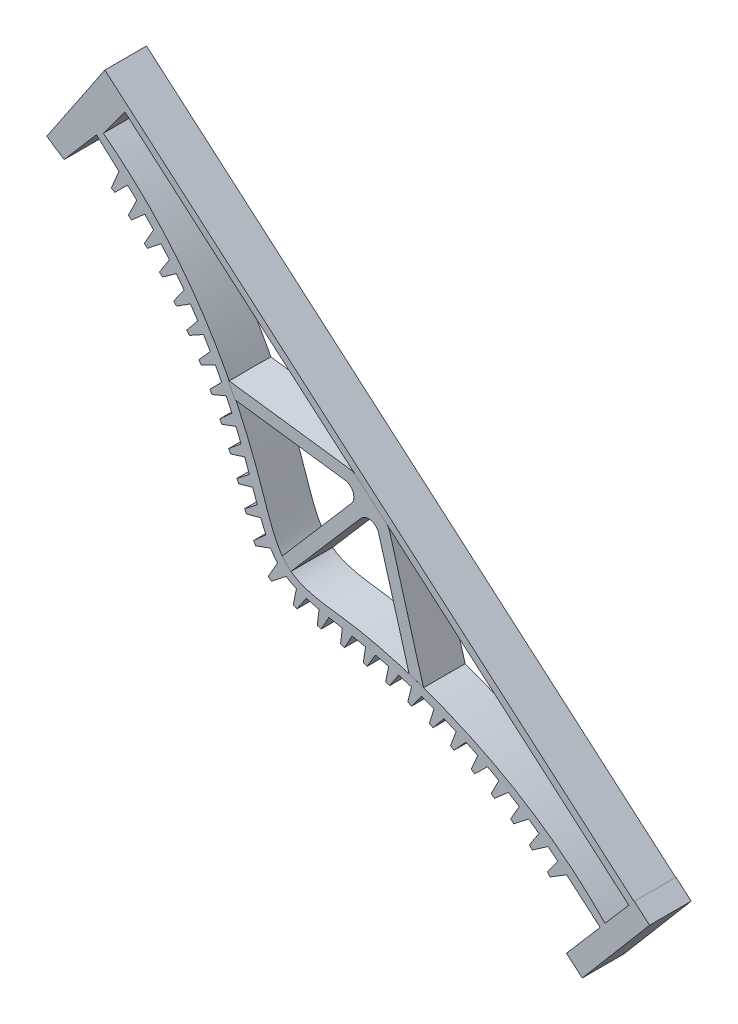
from build123d import *

# Parameters (mm, degrees)
BOSS_EXTRUDE6_DEPTH  = 10.16
BOSS_EXTRUDE8_DEPTH  = 10.16
CRVPATTERN5_DEPTH    = 10.16
CRVPATTERN6_DEPTH    = 10.16
BOSS_EXTRUDE9_DEPTH  = 10.16
CUT_EXTRUDE1_DEPTH   = 156.475771411
BOSS_EXTRUDE14_DEPTH = 10.16
FILLET1_R            = 2.54


# Read off the part's stored shape, not the designer's step: CrvPattern5, CrvPattern6
with BuildPart() as part:
    # Sketch2 → Boss-Extrude6 (new body)
    with BuildSketch(Plane.XY):
        with BuildLine():
            add(Edge.make_bspline(
                [(-35.566744562, -9.717940548), (-35.468273926, -9.80268902), (-35.272184012, -9.972283435), (-34.907747582, -10.289670464), (-34.394942503, -10.740976788), (-33.798605446, -11.272890933), (-33.123111447, -11.886627028), (-32.316267663, -12.633326559), (-31.412693701, -13.490653796), (-30.518151088, -14.360103422), (-29.634400344, -15.240145055), (-28.543077059, -16.353522475), (-26.396607195, -18.615276483), (-23.713782162, -21.656048668), (-20.596239567, -25.554690448), (-17.703677778, -29.621650364), (-15.658303963, -32.755672364), (-14.037784885, -35.419798839), (-12.792049027, -37.581120217), (-11.298499122, -40.318429855), (-9.889444022, -43.100594043), (-8.564055073, -45.923468933), (-7.069419373, -49.353845087), (-5.66633338, -52.822966294), (-4.222966232, -56.712334789), (-2.728926064, -61.014575608), (-1.359536835, -64.920043451), (-0.106422008, -68.089367972), (1.153318255, -70.560325637), (2.146647049, -72.003625432), (2.734637198, -72.70691507), (3.005302915, -73.003115021), (3.012330371, -73.01078778)],
                knots=[0.083325531, 0.083325531, 0.083325531, 0.083325531, 0.083325531, 0.086723077, 0.090120623, 0.093518169, 0.096915715, 0.103710808, 0.1105059, 0.117300992, 0.124096085, 0.130891177, 0.137686269, 0.15127645, 0.192046993, 0.219227344, 0.246407696, 0.259997928, 0.273588159, 0.287178391, 0.300768623, 0.327948999, 0.341539187, 0.355129375, 0.382309728, 0.409490081, 0.431935904, 0.454381728, 0.472501988, 0.483716791, 0.492234559, 0.492461315, 0.492461315, 0.492461315, 0.492461315, 0.492461315], degree=4))
            Line((3.012330371, -73.01078778), (3.72649136, -72.106293556))
            Line((3.72649136, -72.106293556), (5.99059072, -73.893957194))
            Line((5.99059072, -73.893957194), (5.104826211, -74.811688355))
            add(Edge.make_bspline(
                [(5.104826211, -74.811688355), (5.113460155, -74.817494525), (5.446672603, -75.04102028), (6.229700324, -75.517692441), (7.804858241, -76.284958304), (10.435895579, -77.162576083), (13.75651681, -77.929645893), (17.822397533, -78.701988936), (22.299176943, -79.538583191), (26.970692469, -80.513886582), (31.816888291, -81.703226437), (36.010904633, -82.918588605), (39.564133566, -84.093159712), (42.49337208, -85.162386318), (44.816134604, -86.072242532), (47.69193988, -87.277888441), (51.095630104, -88.833571079), (54.435029965, -90.524514354), (57.703065189, -92.347918119), (60.375906986, -93.954370982), (62.482118132, -95.290579627), (64.556074604, -96.677991156), (66.594514759, -98.114049491), (68.34952435, -99.415450724), (69.826596154, -100.557231318), (70.9293454, -101.439077199), (71.637159571, -102.0158813), (72.251943879, -102.526315304), (72.774573956, -102.966153295), (73.142715833, -103.279257697), (73.339627576, -103.447899037), (73.438098212, -103.532647509)],
                knots=[0.507538685, 0.507538685, 0.507538685, 0.507538685, 0.507538685, 0.507765441, 0.516283209, 0.527498012, 0.545618272, 0.568064096, 0.590509919, 0.617690272, 0.644870625, 0.672051001, 0.699231377, 0.712821609, 0.726411841, 0.740002072, 0.753592304, 0.780772656, 0.807953007, 0.821543188, 0.835133369, 0.84872355, 0.862313731, 0.875903915, 0.8894941, 0.896289192, 0.903084285, 0.906481831, 0.909879377, 0.913276923, 0.916674469, 0.916674469, 0.916674469, 0.916674469, 0.916674469], degree=4))
            Line((73.438098212, -103.532647509), (83.064544319, -111.816459153))
            Line((83.064544319, -111.816459153), (91.461797953, -102.288808266))
            Line((91.461797953, -102.288808266), (-39.143763814, 10.116495872))
            Line((-39.143763814, 10.116495872), (-44.961714586, -1.172500931))
            Line((-44.961714586, -1.172500931), (-35.566744562, -9.717940548))
        make_face()
    extrude(amount=BOSS_EXTRUDE6_DEPTH)

    # Sketch2<7> → Boss-Extrude8 (add)
    with BuildSketch(Plane.XY):
        Polygon((1.515996018, -77.644263482), (5.104826211, -74.811688355), (5.99059072, -73.893957194), (3.72649136, -72.106293556), (3.012330371, -73.01078778), (0.745926279, -76.981505157), align=None)
    extrude(amount=BOSS_EXTRUDE8_DEPTH)

    # CrvPattern5 outline → CrvPattern5 (add)
    with BuildSketch(Plane.XY):
        with BuildLine():
            add(Edge.make_bspline(
                [(0.147175899, -68.491062068), (0.327775611, -68.878310959), (0.605306675, -69.446537197), (0.900945427, -70.005719758), (1.220022533, -70.551572208), (1.326099699, -70.726958223)],
                knots=[0.463190678, 0.463190678, 0.463190678, 0.463190678, 0.463190678, 0.472501988, 0.476969023, 0.476969023, 0.476969023, 0.476969023, 0.476969023], degree=4))
            Line((0.147175899, -68.491062068), (-2.838675188, -71.189223171))
            Line((-2.838675188, -71.189223171), (-2.313839213, -72.059167537))
            Line((-2.313839213, -72.059167537), (1.326099699, -70.726958223))
        make_face()
        with BuildLine():
            Line((-36.714305712, -14.542892494), (-33.618073955, -11.438101102))
            add(Edge.make_bspline(
                [(-35.566744562, -9.717940548), (-35.468273926, -9.80268902), (-35.272184012, -9.972283435), (-34.907747582, -10.289670464), (-34.394942503, -10.740976788), (-34.018378593, -11.076860107), (-33.768860143, -11.301597859), (-33.636101524, -11.421771425), (-33.618073955, -11.438101102)],
                knots=[0.083325531, 0.083325531, 0.083325531, 0.083325531, 0.083325531, 0.086723077, 0.090120623, 0.093518169, 0.096915715, 0.097450175, 0.097450175, 0.097450175, 0.097450175, 0.097450175], degree=4))
            Line((-35.566744562, -9.717940548), (-35.683133951, -9.612075549))
            Line((-35.683133951, -9.612075549), (-35.776779601, -9.764905641))
            Line((-35.776779601, -9.764905641), (-37.55739132, -13.975915723))
            Line((-37.55739132, -13.975915723), (-36.714305712, -14.542892494))
        make_face()
        with BuildLine():
            Line((-32.611453468, -18.346695657), (-29.406745404, -15.474808236))
            add(Edge.make_bspline(
                [(-31.353942471, -13.551455916), (-31.25678673, -13.644907913), (-30.935526994, -13.955001159), (-30.445847692, -14.433132295), (-29.96049992, -14.915514742), (-29.573572794, -15.305586998), (-29.406745404, -15.474808236)],
                knots=[0.114362027, 0.114362027, 0.114362027, 0.114362027, 0.114362027, 0.117300992, 0.124096085, 0.129274796, 0.129274796, 0.129274796, 0.129274796, 0.129274796], degree=4))
            Line((-31.353942471, -13.551455916), (-31.407513849, -13.628789028))
            Line((-31.407513849, -13.628789028), (-33.421424113, -17.733341311))
            Line((-33.421424113, -17.733341311), (-32.611453468, -18.346695657))
        make_face()
        with BuildLine():
            Line((-28.729129415, -22.373483259), (-25.434757325, -19.738533799))
            add(Edge.make_bspline(
                [(-27.256709982, -17.722583897), (-27.098956679, -17.892573693), (-26.638343948, -18.391912238), (-26.182126752, -18.895294076), (-25.730357917, -19.402660241), (-25.434757325, -19.738533799)],
                knots=[0.146222357, 0.146222357, 0.146222357, 0.146222357, 0.146222357, 0.15127645, 0.161027324, 0.161027324, 0.161027324, 0.161027324, 0.161027324], degree=4))
            Line((-27.256709982, -17.722583897), (-27.262815225, -17.730420017))
            Line((-27.262815225, -17.730420017), (-29.503472535, -21.715722868))
            Line((-29.503472535, -21.715722868), (-28.729129415, -22.373483259))
        make_face()
        with BuildLine():
            Line((-25.076992645, -26.613245044), (-21.711663157, -24.217879367))
            add(Edge.make_bspline(
                [(-23.396101972, -22.127346621), (-22.989241558, -22.619061041), (-22.565622218, -23.139716039), (-22.146533887, -23.66402646), (-21.732020448, -24.19193057), (-21.711663157, -24.217879367)],
                knots=[0.178138223, 0.178138223, 0.178138223, 0.178138223, 0.178138223, 0.192046993, 0.19276576, 0.19276576, 0.19276576, 0.19276576, 0.19276576], degree=4))
            Line((-23.396101972, -22.127346621), (-25.8132696, -25.913136306))
            Line((-25.8132696, -25.913136306), (-25.076992645, -26.613245044))
        make_face()
        with BuildLine():
            Line((-21.668264101, -31.050120924), (-18.250637845, -28.894773341))
            add(Edge.make_bspline(
                [(-19.793916618, -26.741123604), (-19.543831531, -27.080854092), (-19.154045374, -27.616436332), (-18.76883609, -28.155330611), (-18.388238863, -28.69747331), (-18.250637845, -28.894773341)],
                knots=[0.210033814, 0.210033814, 0.210033814, 0.210033814, 0.210033814, 0.219227344, 0.224469574, 0.224469574, 0.224469574, 0.224469574, 0.224469574], degree=4))
            Line((-19.793916618, -26.741123604), (-22.364252939, -30.309948284))
            Line((-22.364252939, -30.309948284), (-21.668264101, -31.050120924))
        make_face()
        with BuildLine():
            Line((-18.51157843, -35.670849111), (-15.059866497, -33.753609682))
            add(Edge.make_bspline(
                [(-16.460761265, -31.547312925), (-16.347828692, -31.720352463), (-15.992171218, -32.268461795), (-15.641091715, -32.819533041), (-15.294614366, -33.373500481), (-15.059866497, -33.753609682)],
                knots=[0.241904533, 0.241904533, 0.241904533, 0.241904533, 0.241904533, 0.246407696, 0.256143927, 0.256143927, 0.256143927, 0.256143927, 0.256143927], degree=4))
            Line((-16.460761265, -31.547312925), (-19.165326945, -34.893115944))
            Line((-19.165326945, -34.893115944), (-18.51157843, -35.670849111))
        make_face()
        with BuildLine():
            Line((-15.613248862, -40.461630358), (-12.144794009, -38.777556526))
            add(Edge.make_bspline(
                [(-13.404004563, -36.529181078), (-13.096519117, -37.062967332), (-12.779254918, -37.623715989), (-12.466517508, -38.187001351), (-12.158297795, -38.7527492), (-12.144794009, -38.777556526)],
                knots=[0.273753425, 0.273753425, 0.273753425, 0.273753425, 0.273753425, 0.287178391, 0.287793932, 0.287793932, 0.287793932, 0.287793932, 0.287793932], degree=4))
            Line((-13.404004563, -36.529181078), (-16.223253565, -39.649134043))
            Line((-16.223253565, -39.649134043), (-15.613248862, -40.461630358))
        make_face()
        with BuildLine():
            Line((-12.977530001, -45.404264684), (-9.50799753, -43.943923275))
            add(Edge.make_bspline(
                [(-10.629342215, -41.664071345), (-10.342503188, -42.23080561), (-10.060019741, -42.799743841), (-9.78186804, -43.370810587), (-9.50799753, -43.943923275)],
                knots=[0.305556884, 0.305556884, 0.305556884, 0.305556884, 0.305556884, 0.319399691, 0.319399691, 0.319399691, 0.319399691, 0.319399691], degree=4))
            Line((-10.629342215, -41.664071345), (-13.543115872, -44.560245358))
            Line((-13.543115872, -44.560245358), (-12.977530001, -45.404264684))
        make_face()
        with BuildLine():
            Line((-10.597218009, -50.487321483), (-7.138972135, -49.234540975))
            add(Edge.make_bspline(
                [(-8.13141305, -46.933620954), (-8.053153901, -47.110055833), (-7.800375245, -47.683263346), (-7.551564199, -48.25821536), (-7.306630354, -48.834823511), (-7.138972135, -49.234540975)],
                knots=[0.337332826, 0.337332826, 0.337332826, 0.337332826, 0.337332826, 0.341539187, 0.35098558, 0.35098558, 0.35098558, 0.35098558, 0.35098558], degree=4))
            Line((-8.13141305, -46.933620954), (-11.119179378, -49.615649338))
            Line((-11.119179378, -49.615649338), (-10.597218009, -50.487321483))
        make_face()
        with BuildLine():
            Line((-8.45355575, -55.693707904), (-5.01214409, -54.619717645))
            add(Edge.make_bspline(
                [(-5.894901704, -52.307685038), (-5.67332637, -52.874365913), (-5.451200088, -53.451839689), (-5.232096222, -54.030465602), (-5.01572848, -54.610112807), (-5.01214409, -54.619717645)],
                knots=[0.369049416, 0.369049416, 0.369049416, 0.369049416, 0.369049416, 0.382309728, 0.382533149, 0.382533149, 0.382533149, 0.382533149, 0.382533149], degree=4))
            Line((-5.894901704, -52.307685038), (-8.935729155, -54.799412199))
            Line((-8.935729155, -54.799412199), (-8.45355575, -55.693707904))
        make_face()
        with BuildLine():
            Line((-6.492626908, -61.015328849), (-3.058520305, -60.064597128))
            add(Edge.make_bspline(
                [(-3.873512384, -57.75075965), (-3.738120331, -58.131416175), (-3.533633016, -58.709615872), (-3.33036515, -59.288244418), (-3.12765731, -59.867070798), (-3.058520305, -60.064597128)],
                knots=[0.400685205, 0.400685205, 0.400685205, 0.400685205, 0.400685205, 0.409490081, 0.414050888, 0.414050888, 0.414050888, 0.414050888, 0.414050888], degree=4))
            Line((-3.873512384, -57.75075965), (-6.945562957, -60.105875752))
            Line((-6.945562957, -60.105875752), (-6.492626908, -61.015328849))
        make_face()
        with BuildLine():
            Line((-4.576987042, -66.45945404), (-1.103474963, -65.504774469))
            add(Edge.make_bspline(
                [(-1.953749432, -63.201259583), (-1.746716491, -63.779157031), (-1.537061707, -64.356124556), (-1.323425997, -64.931674872), (-1.103474963, -65.504774469)],
                knots=[0.432169486, 0.432169486, 0.432169486, 0.432169486, 0.432169486, 0.445547532, 0.445547532, 0.445547532, 0.445547532, 0.445547532], degree=4))
            Line((-1.953749432, -63.201259583), (-5.028228484, -65.549158945))
            Line((-5.028228484, -65.549158945), (-4.576987042, -66.45945404))
        make_face()
    extrude(amount=CRVPATTERN5_DEPTH)

    # CrvPattern6 outline → CrvPattern6 (add)
    with BuildSketch(Plane.XY):
        with BuildLine():
            add(Edge.make_bspline(
                [(7.612635847, -76.138209395), (7.802286125, -76.217176216), (8.390036842, -76.451612421), (8.987496065, -76.660840512), (9.591210588, -76.850785823), (10.001085785, -76.971699285)],
                knots=[0.523020868, 0.523020868, 0.523020868, 0.523020868, 0.523020868, 0.527498012, 0.536810336, 0.536810336, 0.536810336, 0.536810336, 0.536810336], degree=4))
            Line((7.612635847, -76.138209395), (6.836400945, -79.941204554))
            Line((6.836400945, -79.941204554), (7.774816294, -80.330604904))
            Line((7.774816294, -80.330604904), (10.001085785, -76.971699285))
        make_face()
        with BuildLine():
            add(Edge.make_bspline(
                [(71.447821592, -101.862720744), (71.46640528, -101.877911759), (71.60478574, -101.991106058), (71.863990389, -102.20421103), (72.251943879, -102.526315304), (72.774573956, -102.966153295), (73.142715833, -103.279257697), (73.339627576, -103.447899037), (73.438098212, -103.532647509)],
                knots=[0.902556985, 0.902556985, 0.902556985, 0.902556985, 0.902556985, 0.903084285, 0.906481831, 0.909879377, 0.913276923, 0.916674469, 0.916674469, 0.916674469, 0.916674469, 0.916674469], degree=4))
            Line((71.447821592, -101.862720744), (68.839989673, -105.38525872))
            Line((68.839989673, -105.38525872), (69.526211945, -106.134494993))
            Line((69.526211945, -106.134494993), (73.425048282, -103.74655462))
            Line((73.425048282, -103.74655462), (73.559326039, -103.636967263))
            Line((73.559326039, -103.636967263), (73.438098212, -103.532647509))
        make_face()
        with BuildLine():
            add(Edge.make_bspline(
                [(66.828750745, -98.299499954), (67.020762699, -98.439144342), (67.573367028, -98.843639945), (68.122348031, -99.252998389), (68.667107963, -99.66671309), (69.021591718, -99.939192755)],
                knots=[0.870730933, 0.870730933, 0.870730933, 0.870730933, 0.870730933, 0.875903915, 0.885651447, 0.885651447, 0.885651447, 0.885651447, 0.885651447], degree=4))
            Line((66.828750745, -98.299499954), (64.466803891, -101.895345908))
            Line((64.466803891, -101.895345908), (65.193959074, -102.604924191))
            Line((65.193959074, -102.604924191), (68.95275994, -100.002118003))
            Line((68.95275994, -100.002118003), (69.021591718, -99.939192755))
        make_face()
        with BuildLine():
            add(Edge.make_bspline(
                [(62.020168149, -95.006342176), (62.396299483, -95.248599703), (62.965325296, -95.619778192), (63.531115623, -95.995984783), (64.093494766, -96.377081783), (64.285107056, -96.507767779)],
                knots=[0.838973403, 0.838973403, 0.838973403, 0.838973403, 0.838973403, 0.84872355, 0.85377839, 0.85377839, 0.85377839, 0.85377839, 0.85377839], degree=4))
            Line((62.020168149, -95.006342176), (59.905382527, -98.656383127))
            Line((59.905382527, -98.656383127), (60.67114936, -99.324108489))
            Line((60.67114936, -99.324108489), (64.278225907, -96.51480559))
            Line((64.278225907, -96.51480559), (64.285107056, -96.507767779))
        make_face()
        with BuildLine():
            add(Edge.make_bspline(
                [(57.03601778, -91.991880775), (57.064739492, -92.008162762), (57.635813936, -92.332219743), (58.216830837, -92.668464638), (58.794920697, -93.009747125), (59.341853307, -93.33874795), (59.354411159, -93.346305216)],
                knots=[0.807233486, 0.807233486, 0.807233486, 0.807233486, 0.807233486, 0.807953007, 0.821543188, 0.821862596, 0.821862596, 0.821862596, 0.821862596, 0.821862596], degree=4))
            Line((57.03601778, -91.991880775), (55.168270854, -95.677197187))
            Line((55.168270854, -95.677197187), (55.970238974, -96.300978507))
            Line((55.970238974, -96.300978507), (59.354411159, -93.346305216))
        make_face()
        with BuildLine():
            add(Edge.make_bspline(
                [(51.895515847, -89.265997834), (52.111207082, -89.37272191), (52.704148909, -89.668395645), (53.29456417, -89.969116713), (53.882382155, -90.274857127), (54.255629423, -90.471578342)],
                knots=[0.775528124, 0.775528124, 0.775528124, 0.775528124, 0.775528124, 0.780772656, 0.78996759, 0.78996759, 0.78996759, 0.78996759, 0.78996759], degree=4))
            Line((51.895515847, -89.265997834), (50.272583936, -92.968138858))
            Line((50.272583936, -92.968138858), (51.108169682, -93.546111574))
            Line((51.108169682, -93.546111574), (54.255629423, -90.471578342))
        make_face()
        with BuildLine():
            add(Edge.make_bspline(
                [(46.615311284, -86.834466945), (47.026317236, -87.010048174), (47.625955194, -87.270247748), (48.223411086, -87.535430069), (48.818618399, -87.805583948), (49.006619694, -87.891514132)],
                knots=[0.743852072, 0.743852072, 0.743852072, 0.743852072, 0.743852072, 0.753592304, 0.758097173, 0.758097173, 0.758097173, 0.758097173, 0.758097173], degree=4))
            Line((46.615311284, -86.834466945), (45.232688918, -90.535725226))
            Line((45.232688918, -90.535725226), (46.099125001, -91.066332909))
            Line((46.099125001, -91.066332909), (49.006619694, -87.891514132))
        make_face()
        with BuildLine():
            add(Edge.make_bspline(
                [(41.212861277, -84.700168408), (41.23965634, -84.709918423), (41.845330599, -84.930549695), (42.449240342, -85.15602105), (43.051313853, -85.386342784), (43.625018016, -85.610914728)],
                knots=[0.712200201, 0.712200201, 0.712200201, 0.712200201, 0.712200201, 0.712821609, 0.726248275, 0.726248275, 0.726248275, 0.726248275, 0.726248275], degree=4))
            Line((41.212861277, -84.700168408), (40.063185626, -88.384145395))
            Line((40.063185626, -88.384145395), (40.957483001, -88.866315702))
            Line((40.957483001, -88.866315702), (43.625018016, -85.610914728))
        make_face()
        with BuildLine():
            add(Edge.make_bspline(
                [(35.710983236, -82.862291943), (36.318908486, -83.047863422), (36.925446952, -83.237975745), (37.530524893, -83.432687973), (38.134070584, -83.6320397)],
                knots=[0.680592365, 0.680592365, 0.680592365, 0.680592365, 0.680592365, 0.694444528, 0.694444528, 0.694444528, 0.694444528, 0.694444528], degree=4))
            Line((35.710983236, -82.862291943), (34.782698141, -86.514868176))
            Line((34.782698141, -86.514868176), (35.701552229, -86.948415365))
            Line((35.701552229, -86.948415365), (38.134070584, -83.6320397))
        make_face()
        with BuildLine():
            add(Edge.make_bspline(
                [(30.126105651, -81.307734895), (30.733955159, -81.461407824), (31.340798135, -81.619061116), (31.946556207, -81.780839857), (32.551154804, -81.946843554)],
                knots=[0.649004315, 0.649004315, 0.649004315, 0.649004315, 0.649004315, 0.662668117, 0.662668117, 0.662668117, 0.662668117, 0.662668117], degree=4))
            Line((30.126105651, -81.307734895), (29.401434775, -84.91900415))
            Line((29.401434775, -84.91900415), (30.341132625, -85.30529931))
            Line((30.341132625, -85.30529931), (32.551154804, -81.946843554))
        make_face()
        with BuildLine():
            add(Edge.make_bspline(
                [(24.483821764, -80.006749521), (24.494399807, -80.008978183), (25.100373877, -80.13670152), (25.705744376, -80.267288808), (26.310423925, -80.401045921), (26.903803263, -80.535747741)],
                knots=[0.617454682, 0.617454682, 0.617454682, 0.617454682, 0.617454682, 0.617690272, 0.63095095, 0.63095095, 0.63095095, 0.63095095, 0.63095095], degree=4))
            Line((24.483821764, -80.006749521), (23.933510674, -83.57546647))
            Line((23.933510674, -83.57546647), (24.889648391, -83.91906022))
            Line((24.889648391, -83.91906022), (26.903803263, -80.535747741))
        make_face()
        with BuildLine():
            add(Edge.make_bspline(
                [(18.808377497, -78.885952074), (19.01462133, -78.925013859), (19.617795034, -79.039358737), (20.220856399, -79.154287552), (20.823675078, -79.27048725), (21.220240004, -79.34766621)],
                knots=[0.585935295, 0.585935295, 0.585935295, 0.585935295, 0.585935295, 0.590509919, 0.599314524, 0.599314524, 0.599314524, 0.599314524, 0.599314524], degree=4))
            Line((18.808377497, -78.885952074), (18.379019444, -82.429630891))
            Line((18.379019444, -82.429630891), (19.345793683, -82.742046591))
            Line((19.345793683, -82.742046591), (21.220240004, -79.34766621))
        make_face()
        with BuildLine():
            add(Edge.make_bspline(
                [(13.137669341, -77.762977643), (13.737744425, -77.895264698), (14.339306762, -78.020922405), (14.941679645, -78.142421542), (15.544582597, -78.261184195)],
                knots=[0.554438521, 0.554438521, 0.554438521, 0.554438521, 0.554438521, 0.567830201, 0.567830201, 0.567830201, 0.567830201, 0.567830201], degree=4))
            Line((13.137669341, -77.762977643), (12.710280206, -81.346308044))
            Line((12.710280206, -81.346308044), (13.677634879, -81.656921851))
            Line((13.677634879, -81.656921851), (15.544582597, -78.261184195))
        make_face()
    extrude(amount=CRVPATTERN6_DEPTH)

    # Sketch10 → Boss-Extrude9 (add)
    with BuildSketch(Plane(origin=(0, 0, 0), x_dir=(-1, 0, 0), z_dir=(0, 0, -1))):
        Polygon((39.143763814, 10.116495872), (53.320699118, -10.958952056), (49.105609532, -13.794339117), (33.044571656, 4.867243541), align=None)
        Polygon((-73.514406538, -120.275259903), (-90.093181385, -100.988796466), (-93.819284871, -104.191780307), (-77.388340242, -123.561448828), align=None)
    extrude(amount=-BOSS_EXTRUDE9_DEPTH)

    # Sketch11 → Cut-Extrude1 (cut, through all)
    with BuildSketch(Plane(origin=(0, 0, 0), x_dir=(-1, 0, 0), z_dir=(0, 0, -1))):
        with BuildLine():
            Line((-82.951660387, -109.227881745), (-88.756042224, -102.496325805))
            Line((-88.756042224, -102.496325805), (34.261492575, 3.709827888))
            Line((34.261492575, 3.709827888), (39.531387925, -3.45072845))
            add(Edge.make_bspline(
                [(39.531387925, -3.45072845), (20.731865976, -17.809376852), (5.956680427, -40.343917075), (-4.151174549, -75.277382064), (-20.723983066, -76.476990734), (-47.701979739, -83.169028938), (-70.106525911, -95.792279295), (-82.951660387, -109.227881745)],
                knots=[0, 0, 0, 0, 0.40858933, 0.495156533, 0.572796339, 0.669811009, 1, 1, 1, 1], degree=3))
        make_face()
    extrude(amount=-CUT_EXTRUDE1_DEPTH, mode=Mode.SUBTRACT)


with BuildPart() as body_2:
    # Sketch12 → Boss-Extrude14 (new body)
    with BuildSketch(Plane.XY.offset(10.16)):
        with BuildLine():
            Line((4.1657529, -70.951534825), (24.686564979, -47.182481656))
            Line((24.686564979, -47.182481656), (26.993697896, -49.17432545))
            Line((26.993697896, -49.17432545), (6.28464124, -73.161420447))
            add(Edge.make_bspline(
                [(4.1657529, -70.951534825), (5.070003186, -72.205981174), (6.28464124, -73.161420447)],
                knots=[0, 0, 0, 1, 1, 1], degree=2))
        make_face()
        Polygon((26.993697896, -49.17432545), (26.394772258, -49.868055079), (35.129836307, -80.408522691), (38.634854761, -81.579078647), (30.144634469, -51.894660031), align=None)
        Polygon((-7.400455219, -43.690353319), (24.087639341, -47.876211284), (24.686564979, -47.182481656), (21.535628406, -44.462147076), (-9.069855184, -40.393618666), align=None)
    extrude(amount=-BOSS_EXTRUDE14_DEPTH)

    # Fillet1
    fillet1_edges = [body_2.edges().sort_by_distance(p)[0] for p in [
        (24.087639341, -47.876211284, 5.08),
        (21.535628406, -44.462147076, 5.08),
        (30.144634469, -51.894660031, 5.08),
        (26.394772258, -49.868055079, 5.08),
    ]]
    fillet(fillet1_edges, radius=FILLET1_R)


solid = Compound([part.part, body_2.part])
